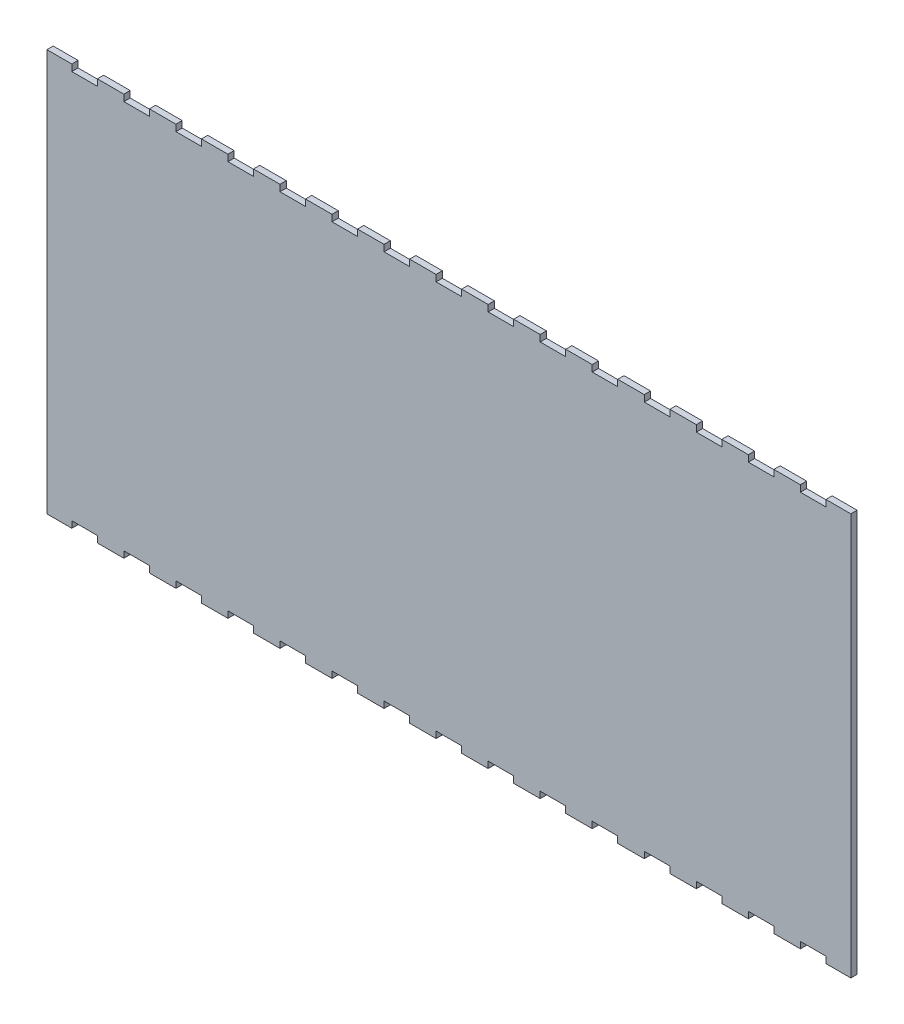
from build123d import *

# Parameters (mm, degrees)
BOSS_EXTRUDE1_DEPTH = 3.175


with BuildPart() as part:
    # Sketch1 → Boss-Extrude1 (new body)
    with BuildSketch(Plane.XY):
        Polygon((393.8, 203.2), (393.8, 199.925), (380.9, 199.925), (380.9, 203.2), (367.492857143, 203.2), (367.492857143, 199.925), (354.592857143, 199.925), (354.592857143, 203.2), (341.185714286, 203.2), (341.185714286, 199.925), (328.285714286, 199.925), (328.285714286, 203.2), (314.878571429, 203.2), (314.878571429, 199.925), (301.978571429, 199.925), (301.978571429, 203.2), (288.571428571, 203.2), (288.571428571, 199.925), (275.671428571, 199.925), (275.671428571, 203.2), (262.264285714, 203.2), (262.264285714, 199.925), (249.364285714, 199.925), (249.364285714, 203.2), (235.957142857, 203.2), (235.957142857, 199.925), (223.057142857, 199.925), (223.057142857, 203.2), (209.65, 203.2), (209.65, 199.925), (196.75, 199.925), (196.75, 203.2), (183.342857143, 203.2), (183.342857143, 199.925), (170.442857143, 199.925), (170.442857143, 203.2), (157.035714286, 203.2), (157.035714286, 199.925), (144.135714286, 199.925), (144.135714286, 203.2), (130.728571429, 203.2), (130.728571429, 199.925), (117.828571429, 199.925), (117.828571429, 203.2), (104.421428571, 203.2), (104.421428571, 199.925), (91.521428571, 199.925), (91.521428571, 203.2), (78.114285714, 203.2), (78.114285714, 199.925), (65.214285714, 199.925), (65.214285714, 203.2), (51.807142857, 203.2), (51.807142857, 199.925), (38.907142857, 199.925), (38.907142857, 203.2), (25.5, 203.2), (25.5, 199.925), (12.6, 199.925), (12.6000002, 203.2254), (0, 203.2254), (0, -0.0254), (12.6000002, -0.0254), (12.6, 3.275), (25.5, 3.275), (25.5, 0), (38.907142857, 0), (38.907142857, 3.275), (51.807142857, 3.275), (51.807142857, 0), (65.214285714, 0), (65.214285714, 3.275), (78.114285714, 3.275), (78.114285714, 0), (91.521428571, 0), (91.521428571, 3.275), (104.421428571, 3.275), (104.421428571, 0), (117.828571429, 0), (117.828571429, 3.275), (130.728571429, 3.275), (130.728571429, 0), (144.135714286, 0), (144.135714286, 3.275), (157.035714286, 3.275), (157.035714286, 0), (170.442857143, 0), (170.442857143, 3.275), (183.342857143, 3.275), (183.342857143, 0), (196.75, 0), (196.75, 3.275), (209.65, 3.275), (209.65, 0), (223.057142857, 0), (223.057142857, 3.275), (235.957142857, 3.275), (235.957142857, 0), (249.364285714, 0), (249.364285714, 3.275), (262.264285714, 3.275), (262.264285714, 0), (275.671428571, 0), (275.671428571, 3.275), (288.571428571, 3.275), (288.571428571, 0), (301.978571429, 0), (301.978571429, 3.275), (314.878571429, 3.275), (314.878571429, 0), (328.285714286, 0), (328.285714286, 3.275), (341.185714286, 3.275), (341.185714286, 0), (354.592857143, 0), (354.592857143, 3.275), (367.492857143, 3.275), (367.492857143, 0), (380.9, 0), (380.9, 3.275), (393.8, 3.275), (393.8, 0), (406.4, 0), (406.4, 203.2), align=None)
    extrude(amount=BOSS_EXTRUDE1_DEPTH)


solid = part.part
